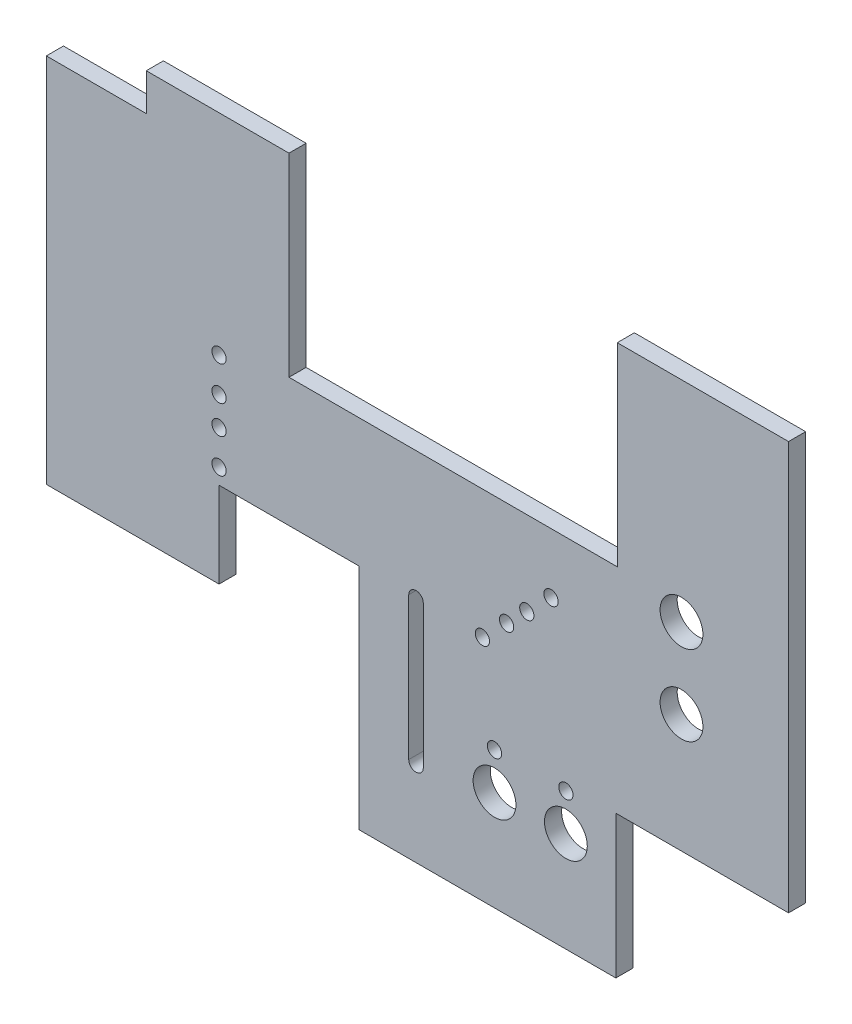
from build123d import *

# Parameters (mm, degrees)
ESBO_O1_R                = 2.5
ESBO_O1_R_2              = 7.5
RESSALTO_EXTRUS_O1_DEPTH = 6


with BuildPart() as part:
    # Esboço1 → Ressalto-extrusão1 (new body)
    with BuildSketch(Plane.XY):
        Polygon((-45, 28.5), (-45, 96.5), (-95, 96.5), (-95, 83.5), (-130, 83.5), (-130, -46.5), (-69.5, -46.5), (-69.5, -16.5), (-20.5, -16.5), (-20.5, -96.5), (69.5, -96.5), (69.5, -46.5), (130, -46.5), (130, 96.5), (70, 96.5), (70, 28.5), align=None)
        with Locations((-69.5, -11)):
            Circle(ESBO_O1_R, mode=Mode.SUBTRACT)
        with BuildLine():
            ThreePointArc((2.05, -66.5), (-0.5, -69.05), (-3.05, -66.5))
            Line((-3.05, -66.5), (-3.05, -16.5))
            ThreePointArc((-3.05, -16.5), (-0.5, -13.95), (2.05, -16.5))
            Line((2.05, -16.5), (2.05, -66.5))
        make_face(mode=Mode.SUBTRACT)
        with Locations((27, -61.5)):
            Circle(ESBO_O1_R_2, mode=Mode.SUBTRACT)
        with Locations((27, -48.5)):
            Circle(ESBO_O1_R, mode=Mode.SUBTRACT)
        with Locations((52, -61.5)):
            Circle(ESBO_O1_R_2, mode=Mode.SUBTRACT)
        with Locations((52, -48.5)):
            Circle(ESBO_O1_R, mode=Mode.SUBTRACT)
        with Locations((22.757359313, -16.5)):
            Circle(ESBO_O1_R, mode=Mode.SUBTRACT)
        with Locations((31.242640687, -8.014718626)):
            Circle(ESBO_O1_R, mode=Mode.SUBTRACT)
        with Locations((38.313708499, -0.943650814)):
            Circle(ESBO_O1_R, mode=Mode.SUBTRACT)
        with Locations((92.5, -5)):
            Circle(ESBO_O1_R_2, mode=Mode.SUBTRACT)
        with Locations((-69.5, 1)):
            Circle(ESBO_O1_R, mode=Mode.SUBTRACT)
        with Locations((-69.5, 11)):
            Circle(ESBO_O1_R, mode=Mode.SUBTRACT)
        with Locations((-69.5, 23)):
            Circle(ESBO_O1_R, mode=Mode.SUBTRACT)
        with Locations((46.798989873, 7.54163056)):
            Circle(ESBO_O1_R, mode=Mode.SUBTRACT)
        with Locations((92.5, 23)):
            Circle(ESBO_O1_R_2, mode=Mode.SUBTRACT)
    extrude(amount=RESSALTO_EXTRUS_O1_DEPTH)


solid = part.part
